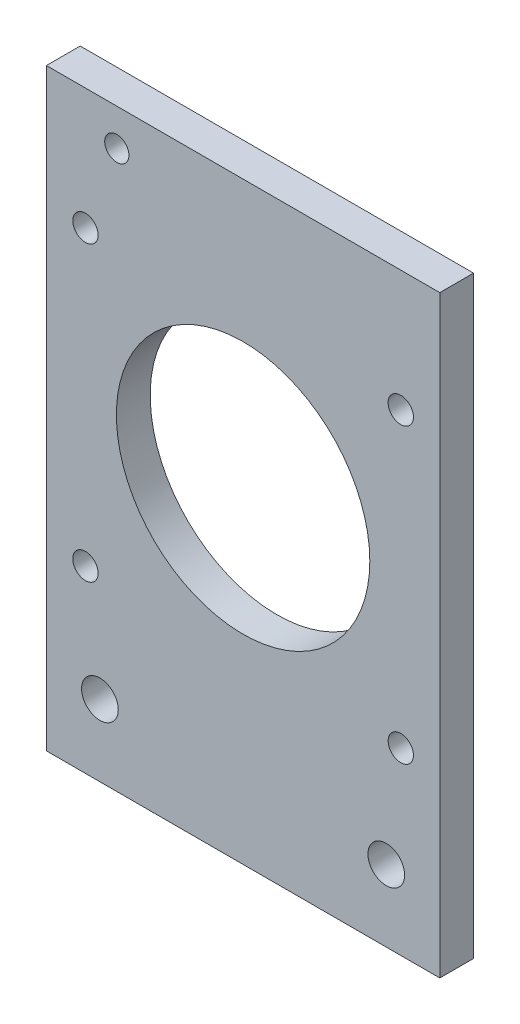
from build123d import *

# Parameters (mm, degrees)
SKETCH2_R           = 22.5
BOSS_EXTRUDE1_DEPTH = 3
SKETCH3_R           = 3.25755
SKETCH3_R_2         = 2.15
CUT_EXTRUDE1_DEPTH  = 6
SKETCH4_R           = 2.25
CUT_EXTRUDE2_DEPTH  = 10


with BuildPart() as part:
    # Sketch2 → Boss-Extrude1 (new, symmetric)
    with BuildSketch(Plane.XY):
        Polygon((-34.925, 0), (34.925, 0), (34.925, 57.9), (34.925, 90.4), (34.925, 105.4), (-34.925, 105.4), (-34.925, 90.4), (-34.925, 57.9), align=None)
        with Locations((0, 57.9)):
            Circle(SKETCH2_R, mode=Mode.SUBTRACT)
    extrude(amount=BOSS_EXTRUDE1_DEPTH, both=True)

    # Sketch3 → Cut-Extrude1 (cut)
    with BuildSketch(Plane.XY.offset(3)):
        with Locations((-25.425, 12.7)):
            Circle(SKETCH3_R)
        with Locations((25.425, 12.7)):
            Circle(SKETCH3_R)
        with Locations((-22.425, 98.9)):
            Circle(SKETCH3_R_2)
    extrude(amount=-CUT_EXTRUDE1_DEPTH, mode=Mode.SUBTRACT)

    # Sketch4 → Cut-Extrude2 (cut)
    with BuildSketch(Plane.XY.offset(3)):
        with Locations((-28, 31.9)):
            Circle(SKETCH4_R)
        with Locations((28, 83.9)):
            Circle(SKETCH4_R)
        with Locations((-28, 83.9)):
            Circle(SKETCH4_R)
        with Locations((28, 31.9)):
            Circle(SKETCH4_R)
    extrude(amount=-CUT_EXTRUDE2_DEPTH, mode=Mode.SUBTRACT)


solid = part.part
